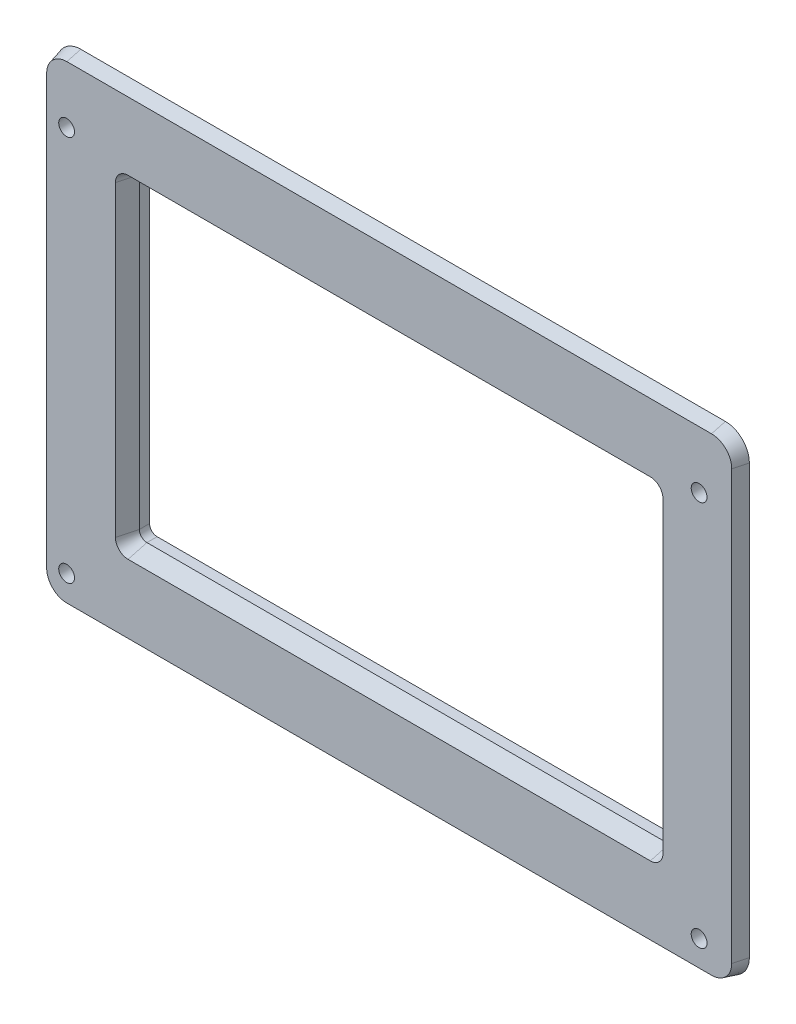
from build123d import *

# Parameters (mm, degrees)
SKETCH1_W                    = 139.7
SKETCH1_H                    = 96.266
BOSS_EXTRUDE1_DEPTH          = 2.794
F_1_8_0_125_DIAMETER_HOLE1_D = 3.175
SKETCH4_W                    = 107.9999999
SKETCH4_H                    = 64.79999994
CUT_EXTRUDE1_DEPTH           = 85.874110452
FILLET1_R                    = 1.524
FILLET2_R                    = 5.08
BOSS_EXTRUDE2_START          = 3.048
SKETCH5_W                    = 113.0799999
SKETCH5_H                    = 69.75759988
BOSS_EXTRUDE2_DEPTH          = 3.048
FILLET3_R                    = 1.524
CHAMFER1_SIZE                = 1.016
CHAMFER1_SIZE2               = 3.79176362
CHAMFER2_SIZE                = 1.016
CHAMFER2_SIZE_2              = 3.79176362


with BuildPart() as part:
    # Sketch1 → Boss-Extrude1 (new body)
    with BuildSketch(Plane.XY):
        Rectangle(SKETCH1_W, SKETCH1_H)
    extrude(amount=BOSS_EXTRUDE1_DEPTH)

    # 1/8 (0.125) Diameter Hole1 (through all)
    with Locations(Plane.XY.offset(2.794)):
        with Locations((-64.82, -41.975), (-64.82, 35.625), (62.28, -41.975), (62.28, 35.625)):
            Hole(F_1_8_0_125_DIAMETER_HOLE1_D / 2)

    # Sketch4 → Cut-Extrude1 (cut, through all)
    with BuildSketch(Plane.XY.offset(2.794)):
        with Locations((0, 0.06120003)):
            Rectangle(SKETCH4_W, SKETCH4_H)
    extrude(amount=-CUT_EXTRUDE1_DEPTH, mode=Mode.SUBTRACT)

    # Fillet1
    fillet1_edges = [part.edges().sort_by_distance(p)[0] for p in [
        (53.99999995, 32.4612, 1.397),
        (53.99999995, -32.33879994, 1.397),
        (-53.99999995, -32.33879994, 1.397),
        (-53.99999995, 32.4612, 1.397),
    ]]
    fillet(fillet1_edges, radius=FILLET1_R)

    # Fillet2
    fillet2_edges = [part.edges().sort_by_distance(p)[0] for p in [
        (69.85, -48.133, 1.397),
        (-69.85, -48.133, 1.397),
        (-69.85, 48.133, 1.397),
        (69.85, 48.133, 1.397),
    ]]
    fillet(fillet2_edges, radius=FILLET2_R)

    # Sketch5 → Boss-Extrude2 (add)
    with BuildSketch(Plane(origin=(0, 0, 0), x_dir=(-1, 0, 0), z_dir=(0, 0, -1)).offset(BOSS_EXTRUDE2_START)):
        Rectangle(SKETCH5_W, SKETCH5_H)
        with BuildLine():
            Line((-53.99999995, -30.81479994), (-53.99999995, 30.9372))
            ThreePointArc((-53.99999995, 30.9372), (-53.553630685, 32.014830735), (-52.47599995, 32.4612))
            Line((-52.47599995, 32.4612), (52.47599995, 32.4612))
            ThreePointArc((52.47599995, 32.4612), (53.553630685, 32.014830735), (53.99999995, 30.9372))
            Line((53.99999995, 30.9372), (53.99999995, -30.81479994))
            ThreePointArc((53.99999995, -30.81479994), (53.553630685, -31.892430675), (52.47599995, -32.33879994))
            Line((52.47599995, -32.33879994), (-52.47599995, -32.33879994))
            ThreePointArc((-52.47599995, -32.33879994), (-53.553630685, -31.892430675), (-53.99999995, -30.81479994))
        make_face(mode=Mode.SUBTRACT)
    extrude(amount=-BOSS_EXTRUDE2_DEPTH)

    # Fillet3
    fillet3_edges = [part.edges().sort_by_distance(p)[0] for p in [
        (-56.53999995, -34.87879994, -1.524),
        (-56.53999995, 34.87879994, -1.524),
        (56.53999995, 34.87879994, -1.524),
        (56.53999995, -34.87879994, -1.524),
    ]]
    fillet(fillet3_edges, radius=FILLET3_R)

    # Chamfer1
    chamfer1_edges = [part.edges().sort_by_distance(p)[0] for p in [
        (0, -32.33879994, 2.794),
        (-53.99999995, 0.06120003, 2.794),
        (53.99999995, 0.06120003, 2.794),
        (0, 32.4612, 2.794),
        (-53.553630685, -31.892430675, 2.794),
        (53.553630685, -31.892430675, 2.794),
        (53.553630685, 32.014830735, 2.794),
        (-53.553630685, 32.014830735, 2.794),
    ]]
    chamfer1_side = [part.faces().sort_by_distance(p)[0] for p in [
        (0, -46.436437807, 2.794),
    ]]
    chamfer(chamfer1_edges, length=CHAMFER1_SIZE, length2=CHAMFER1_SIZE2, reference=chamfer1_side[0])

    # Chamfer2
    # the kernel refuses this chamfer: 3.79176362, 1.016 mm, written as the material it takes off along each edge
    with BuildSketch(Plane(origin=(-69.85, 43.053, 2.794), x_dir=(0.9905000388259543, 0, 0.13751244702129017), z_dir=(0, -1, 0)), Plane(origin=(69.85, -43.053, 2.794), x_dir=(-0.9905000388259543, 0, 0.13751244702129017), z_dir=(0, 1, 0))) as chamfer2_piece_1:
        Polygon((CHAMFER2_SIZE * 0.990500038826, -CHAMFER2_SIZE * 0.137512447021), (-CHAMFER2_SIZE_2 * 0.137512447039, -CHAMFER2_SIZE_2 * 0.990500038954), (0, 0), align=None)
    extrude(amount=86.106, mode=Mode.SUBTRACT)
    with BuildSketch(Plane(origin=(-64.77, -43.053, 2.794), x_dir=(0, -1, 0), z_dir=(1, 0, 0))) as chamfer2_piece_2:
        Polygon((5.08 - CHAMFER2_SIZE, 0), (5.08, CHAMFER2_SIZE_2), (5.08, 0), align=None)
    revolve(axis=Axis((-64.77, -43.053, 2.794), (0, 0, -1)), revolution_arc=90, mode=Mode.SUBTRACT)
    with BuildSketch(Plane(origin=(-64.77, -48.133, 2.794), x_dir=(0, 0.990500038825954, 0.13751244702129148), z_dir=(1, 0, 0)), Plane(origin=(64.77, 48.133, 2.794), x_dir=(0, -0.990500038825954, 0.13751244702129148), z_dir=(-1, 0, 0))) as chamfer2_piece_3:
        Polygon((CHAMFER2_SIZE * 0.990500038826, -CHAMFER2_SIZE * 0.137512447021), (-CHAMFER2_SIZE_2 * 0.137512447039, -CHAMFER2_SIZE_2 * 0.990500038954), (0, 0), align=None)
    extrude(amount=129.54, mode=Mode.SUBTRACT)
    with BuildSketch(Plane(origin=(64.77, -43.053, 2.794), x_dir=(0, -1, 0), z_dir=(-1, 0, 0))) as chamfer2_piece_4:
        Polygon((5.08 - CHAMFER2_SIZE, 0), (5.08, -CHAMFER2_SIZE_2), (5.08, 0), align=None)
    revolve(axis=Axis((64.77, -43.053, 2.794), (0, 0, 1)), revolution_arc=90, mode=Mode.SUBTRACT)
    with BuildSketch(Plane(origin=(64.77, 43.053, 2.794), x_dir=(1, 0, 0), z_dir=(0, -1, 0))) as chamfer2_piece_5:
        Polygon((5.08 - CHAMFER2_SIZE, 0), (5.08, -CHAMFER2_SIZE_2), (5.08, 0), align=None)
    revolve(axis=Axis((64.77, 43.053, 2.794), (0, 0, 1)), revolution_arc=90, mode=Mode.SUBTRACT)
    with BuildSketch(Plane(origin=(-64.77, 43.053, 2.794), x_dir=(-1, 0, 0), z_dir=(0, -1, 0))) as chamfer2_piece_6:
        Polygon((5.08 - CHAMFER2_SIZE, 0), (5.08, CHAMFER2_SIZE_2), (5.08, 0), align=None)
    revolve(axis=Axis((-64.77, 43.053, 2.794), (0, 0, -1)), revolution_arc=90, mode=Mode.SUBTRACT)


solid = part.part
